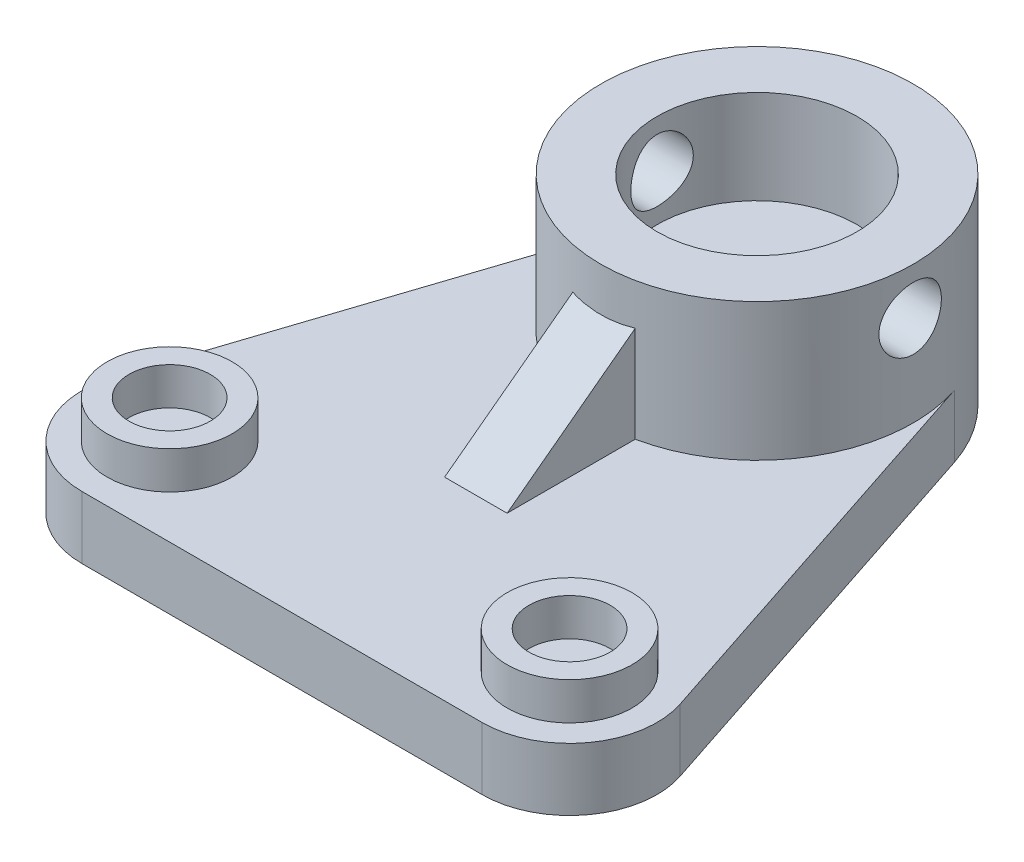
from build123d import *

# Parameters (mm, degrees)
SALIENTE_EXTRUIR1_DEPTH = 10
CROQUIS2_R              = 25
SALIENTE_EXTRUIR3_DEPTH = 32
CROQUIS4_R              = 16
CORTAR_EXTRUIR1_DEPTH   = 15
CORTAR_EXTRUIR2_START   = -25.000000112
CORTAR_EXTRUIR2_DEPTH   = 50.000000224
NERVIO1_REACH           = 117.503
CROQUIS8_WALL_W         = 258.006455054
CROQUIS8_WALL_H         = 10
CROQUIS9_R              = 10
CROQUIS9_R_2            = 6.5
SALIENTE_EXTRUIR4_DEPTH = 6


# Read off the part's stored shape, not the designer's step: Cortar-Extruir2
with BuildPart() as part:
    # Croquis1 → Saliente-Extruir1 (new body)
    with BuildSketch(Plane(origin=(0, 0, 0), x_dir=(1, 0, 0), z_dir=(0, 1, 0))):
        with BuildLine():
            Line((-45.297427526, 18.379317433), (-23.745406297, 83.820209702))
            ThreePointArc((-23.745406297, 83.820209702), (0, 51), (23.745406297, 83.820209702))
            Line((23.745406297, 83.820209702), (45.297427526, 18.379317433))
            ThreePointArc((45.297427526, 18.379317433), (43.342628533, 5.793613586), (32, 0))
            Line((32, 0), (-32, 0))
            ThreePointArc((-32, 0), (-43.342628533, 5.793613586), (-45.297427526, 18.379317433))
        make_face()
    extrude(amount=SALIENTE_EXTRUIR1_DEPTH)

    # Croquis2 → Saliente-Extruir3 (add)
    with BuildSketch(Plane(origin=(0, 0, 0), x_dir=(1, 0, 0), z_dir=(0, 1, 0))):
        with Locations(Location((0, 76, 0), (0, 0, 161.771441232))):
            Circle(CROQUIS2_R)
    extrude(amount=SALIENTE_EXTRUIR3_DEPTH)

    # Croquis4 → Cortar-Extruir1 (cut)
    with BuildSketch(Plane(origin=(0, 32, 0), x_dir=(1, 0, 0), z_dir=(0, 1, 0))):
        with Locations(Location((0, 76, 0), (0, 0, 270))):
            Circle(CROQUIS4_R)
    extrude(amount=-CORTAR_EXTRUIR1_DEPTH, mode=Mode.SUBTRACT)

    # Cortar-Extruir2 outline → Cortar-Extruir2 (cut)
    with BuildSketch(Plane(origin=(0, 0, 0), x_dir=(0, 0, -1), z_dir=(1, 0, 0)).offset(CORTAR_EXTRUIR2_START)):
        with BuildLine():
            add(Edge.make_bspline(
                [(71, 24.5), (71, 25.830324865), (71.548602551, 27.119839879), (73.380983998, 28.951882233), (74.682846227, 29.499135225), (77.310580087, 29.500862615), (78.614537315, 28.956974901), (80.458235075, 27.112387922), (80.999440282, 25.812671971), (81.000558807, 23.191595456), (80.460035839, 21.889945603), (78.61477129, 20.042727881), (77.319144976, 19.500263352), (74.682852162, 19.499736848), (73.382124852, 20.047206111), (71.548344872, 21.880188876), (71, 23.169675135), (71, 24.5)],
                knots=[0, 0, 0, 0, 0.125, 0.125, 0.25, 0.25, 0.375, 0.375, 0.5, 0.5, 0.625, 0.625, 0.75, 0.75, 0.875, 0.875, 1, 1, 1, 1], degree=3))
        make_face()
    extrude(amount=CORTAR_EXTRUIR2_DEPTH, mode=Mode.SUBTRACT)

    # Croquis8 wall → Nervio1 (add, up to next)
    with BuildSketch(Plane(origin=(0, 17.5, -41.00002412), x_dir=(0, 0.600000926209, -0.799999305342), z_dir=(0, 0.799999305342, 0.600000926209)), mode=Mode.PRIVATE) as nervio1_sk1:
        Rectangle(CROQUIS8_WALL_W, CROQUIS8_WALL_H)
    nervio1_tool1 = extrude(nervio1_sk1.sketch, amount=-NERVIO1_REACH, mode=Mode.PRIVATE) - part.part
    add(nervio1_tool1.solids().sort_by_distance((0, 17.5, -41.00002412))[0])

    # Croquis9 → Saliente-Extruir4 (add)
    # profile 1 of 2: a face of its own
    with BuildSketch(Plane(origin=(0, 10, 0), x_dir=(1, 0, 0), z_dir=(0, 1, 0))):
        with Locations(Location((-32, 14, 0), (0, 0, 270))):
            Circle(CROQUIS9_R)
        with Locations(Location((-32, 14, 0), (0, 0, 270))):
            Circle(CROQUIS9_R_2, mode=Mode.SUBTRACT)
    # profile 2 of 2: a face of its own
    with BuildSketch(Plane(origin=(0, 10, 0), x_dir=(1, 0, 0), z_dir=(0, 1, 0))):
        with Locations(Location((32, 14, 0), (0, 0, 90))):
            Circle(CROQUIS9_R)
        with Locations(Location((32, 14, 0), (0, 0, 90))):
            Circle(CROQUIS9_R_2, mode=Mode.SUBTRACT)
    extrude(amount=SALIENTE_EXTRUIR4_DEPTH)


solid = part.part
